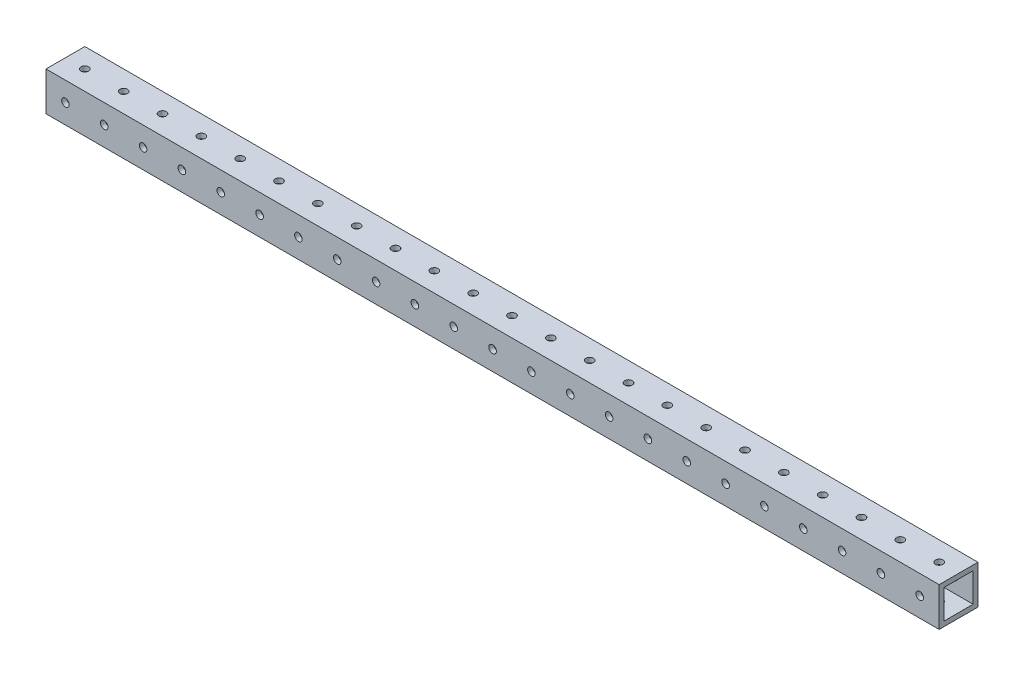
from build123d import *

# Parameters (mm, degrees)
SKETCH1_W             = 25.4
SKETCH1_H             = 25.4
SKETCH1_W_2           = 19.05
SKETCH1_H_2           = 19.05
BOSS_EXTRUDE1_DEPTH   = 292.1
SKETCH3_W             = 2.4892
SKETCH3_H             = 25.4
SKETCH3_AT_POINT_2_W  = 2.4892
SKETCH3_AT_POINT_2_H  = 25.4
LPATTERN1_START       = -12.7
LPATTERN1_OUTLINE_R   = 2.4892
LPATTERN1_DEPTH       = 25.4
LPATTERN1_2_OUTLINE_R = 2.4892
LPATTERN1_2_DEPTH     = 25.4


# Read off the part's stored shape, not the designer's step: LPattern1
with BuildPart() as part:
    # Sketch1 → Boss-Extrude1 (new, symmetric)
    with BuildSketch(Plane(origin=(0, 0, 0), x_dir=(0, 0, -1), z_dir=(1, 0, 0))):
        Rectangle(SKETCH1_W, SKETCH1_H)
        Rectangle(SKETCH1_W_2, SKETCH1_H_2, mode=Mode.SUBTRACT)
    extrude(amount=BOSS_EXTRUDE1_DEPTH, both=True)

    # Sketch3 → #9 (0.196) Diameter Hole1 (revolve, cut)
    with BuildSketch(Plane(origin=(279.4, 12.7, 0), x_dir=(0, 0, 1), z_dir=(1, 0, 0))):
        with Locations((1.2446, 12.7)):
            Rectangle(SKETCH3_W, SKETCH3_H)
    revolve(axis=Axis((279.4, 19.05, 0), (0, -1, 0)), mode=Mode.SUBTRACT)

    # Sketch3 at point 2 (carried to point 2, square into its face) → #9 (0.196) Diameter Hole1 at 2 (revolve, cut)
    with BuildSketch(Plane(origin=(279.400011186, 0.016856195, 12.7), x_dir=(0, -1, 0), z_dir=(1, 0, 0))):
        with Locations((1.2446, 12.7)):
            Rectangle(SKETCH3_AT_POINT_2_W, SKETCH3_AT_POINT_2_H)
    revolve(axis=Axis((279.400011186, 0.016856195, 19.05), (0, 0, -1)), mode=Mode.SUBTRACT)

    # LPattern1 outline → LPattern1 (cut)
    with BuildSketch(Plane.XY.offset(LPATTERN1_START)):
        with Locations((254.000011186, 0.016856195)):
            Circle(LPATTERN1_OUTLINE_R)
        with Locations((228.600011186, 0.016856195)):
            Circle(LPATTERN1_OUTLINE_R)
        with Locations((203.200011186, 0.016856195)):
            Circle(LPATTERN1_OUTLINE_R)
        with Locations((177.800011186, 0.016856195)):
            Circle(LPATTERN1_OUTLINE_R)
        with Locations((152.400011186, 0.016856195)):
            Circle(LPATTERN1_OUTLINE_R)
        with Locations((127.000011186, 0.016856195)):
            Circle(LPATTERN1_OUTLINE_R)
        with Locations((101.600011186, 0.016856195)):
            Circle(LPATTERN1_OUTLINE_R)
        with Locations((76.200011186, 0.016856195)):
            Circle(LPATTERN1_OUTLINE_R)
        with Locations((50.800011186, 0.016856195)):
            Circle(LPATTERN1_OUTLINE_R)
        with Locations((25.400011186, 0.016856195)):
            Circle(LPATTERN1_OUTLINE_R)
        with Locations((1.1186e-05, 0.016856195)):
            Circle(LPATTERN1_OUTLINE_R)
        with Locations((-25.399988814, 0.016856195)):
            Circle(LPATTERN1_OUTLINE_R)
        with Locations((-50.799988814, 0.016856195)):
            Circle(LPATTERN1_OUTLINE_R)
        with Locations((-76.199988814, 0.016856195)):
            Circle(LPATTERN1_OUTLINE_R)
        with Locations((-101.599988814, 0.016856195)):
            Circle(LPATTERN1_OUTLINE_R)
        with Locations((-126.999988814, 0.016856195)):
            Circle(LPATTERN1_OUTLINE_R)
        with Locations((-152.399988814, 0.016856195)):
            Circle(LPATTERN1_OUTLINE_R)
        with Locations((-177.799988814, 0.016856195)):
            Circle(LPATTERN1_OUTLINE_R)
        with Locations((-203.199988814, 0.016856195)):
            Circle(LPATTERN1_OUTLINE_R)
        with Locations((-228.599988814, 0.016856195)):
            Circle(LPATTERN1_OUTLINE_R)
        with Locations((-253.999988814, 0.016856195)):
            Circle(LPATTERN1_OUTLINE_R)
        with Locations((-279.399988814, 0.016856195)):
            Circle(LPATTERN1_OUTLINE_R)
    extrude(amount=LPATTERN1_DEPTH, mode=Mode.SUBTRACT)

    # LPattern1 2 outline → LPattern1 2 (cut)
    with BuildSketch(Plane(origin=(0, 0, 0), x_dir=(1, 0, 0), z_dir=(0, 1, 0)).offset(LPATTERN1_START)):
        with Locations((254, 0)):
            Circle(LPATTERN1_2_OUTLINE_R)
        with Locations((228.6, 0)):
            Circle(LPATTERN1_2_OUTLINE_R)
        with Locations((203.2, 0)):
            Circle(LPATTERN1_2_OUTLINE_R)
        with Locations((177.8, 0)):
            Circle(LPATTERN1_2_OUTLINE_R)
        with Locations((152.4, 0)):
            Circle(LPATTERN1_2_OUTLINE_R)
        with Locations((127, 0)):
            Circle(LPATTERN1_2_OUTLINE_R)
        with Locations((101.6, 0)):
            Circle(LPATTERN1_2_OUTLINE_R)
        with Locations((76.2, 0)):
            Circle(LPATTERN1_2_OUTLINE_R)
        with Locations((50.8, 0)):
            Circle(LPATTERN1_2_OUTLINE_R)
        with Locations((25.4, 0)):
            Circle(LPATTERN1_2_OUTLINE_R)
        Circle(LPATTERN1_2_OUTLINE_R)
        with Locations((-25.4, 0)):
            Circle(LPATTERN1_2_OUTLINE_R)
        with Locations((-50.8, 0)):
            Circle(LPATTERN1_2_OUTLINE_R)
        with Locations((-76.2, 0)):
            Circle(LPATTERN1_2_OUTLINE_R)
        with Locations((-101.6, 0)):
            Circle(LPATTERN1_2_OUTLINE_R)
        with Locations((-127, 0)):
            Circle(LPATTERN1_2_OUTLINE_R)
        with Locations((-152.4, 0)):
            Circle(LPATTERN1_2_OUTLINE_R)
        with Locations((-177.8, 0)):
            Circle(LPATTERN1_2_OUTLINE_R)
        with Locations((-203.2, 0)):
            Circle(LPATTERN1_2_OUTLINE_R)
        with Locations((-228.6, 0)):
            Circle(LPATTERN1_2_OUTLINE_R)
        with Locations((-254, 0)):
            Circle(LPATTERN1_2_OUTLINE_R)
        with Locations((-279.4, 0)):
            Circle(LPATTERN1_2_OUTLINE_R)
    extrude(amount=LPATTERN1_2_DEPTH, mode=Mode.SUBTRACT)


solid = part.part
